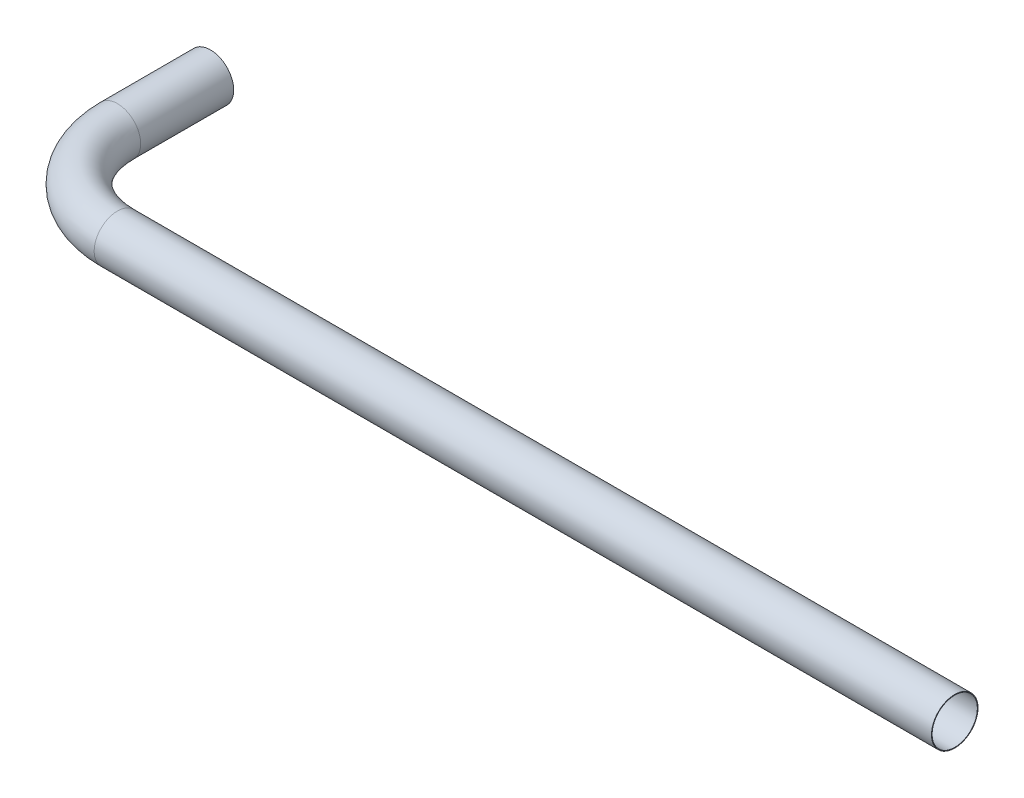
from build123d import *

# Parameters (mm, degrees)
SKETCH1_R   = 3.175
SKETCH1_R_2 = 3.0861


with BuildPart() as part:
    # Sweep1: sweep along a curve in space
    with BuildLine() as sweep1_path:
        Line((0, 0, 0), (0, 0, 12.7))
        ThreePointArc((0, 0, 12.7), (3.719743879, 0, 21.680256121), (12.7, 0, 25.4))
        Line((12.7, 0, 25.4), (127, 0, 25.4))
    # Sketch1 → Sweep1 (sweep)
    with BuildSketch(Plane.XY):
        Circle(SKETCH1_R)
        Circle(SKETCH1_R_2, mode=Mode.SUBTRACT)
    sweep(path=sweep1_path.line)


solid = part.part
